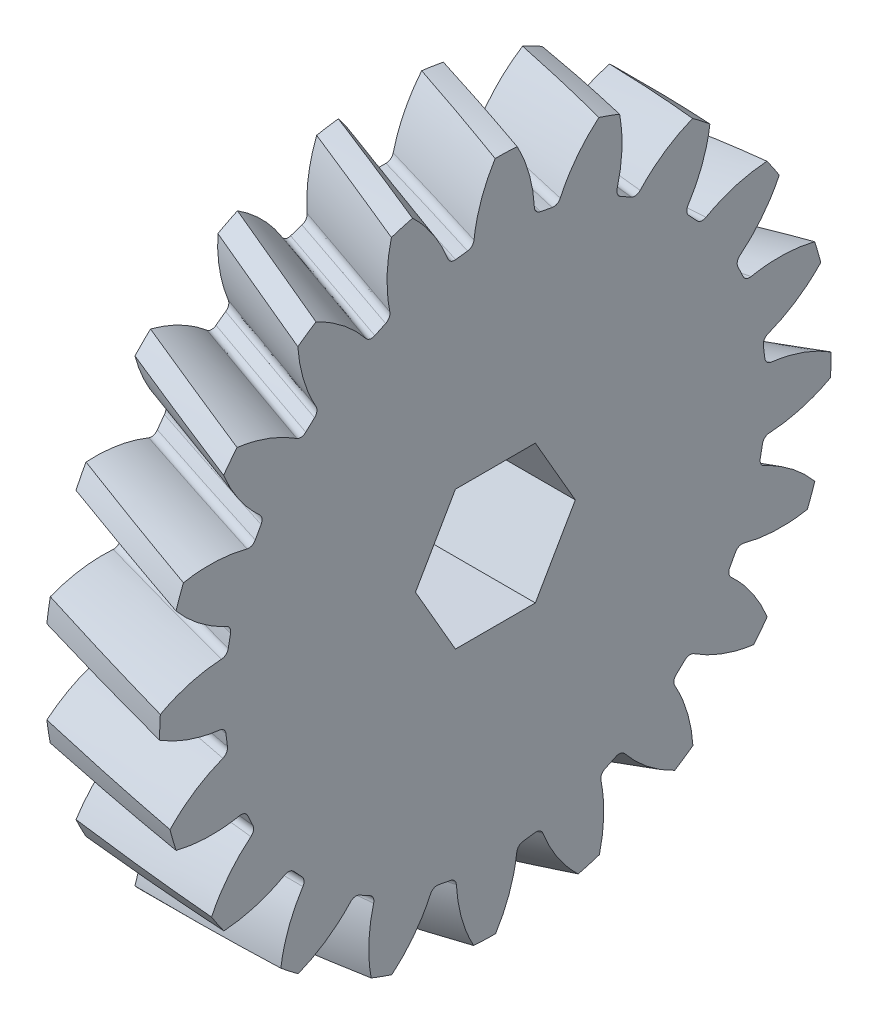
from build123d import *

# Parameters (mm, degrees)
BASPROSKE_W            = 5
BASPROSKE_H            = 14.552222156
TOOTHCUTRH_PITCH       = 251.213697794
TOOTHCUTRH_HEIGHT      = 5
TOOTHCUTRH_RADIUS      = 14.552222156
TOOTHCUTRH_START_ANGLE = -90
TEETHCUTSRH_COUNT      = 20
TEETHCUTSRH_ANGLE      = 342
BORSKE_R               = 0.4
BORE_DEPTH             = 62.5000025
CUT_EXTRUDE1_DEPTH     = 22.178629469


with BuildPart() as part:
    # BasProSke → Base-Revolve (revolve)
    with BuildSketch(Plane(origin=(0, 0, 0), x_dir=(1, 0, 0), z_dir=(0, 1, 0)), mode=Mode.PRIVATE) as base_revolve_sk:
        with Locations((2.5, 7.276111078)):
            Rectangle(BASPROSKE_W, BASPROSKE_H)
    revolve(base_revolve_sk.sketch.rotate(Axis((-10, 0, 0), (1, 0, 0)), 180), axis=Axis((-10, 0, 0), (1, 0, 0)))

    # ToothCutRH: sweep along a helix
    with BuildLine() as toothcutrh_path:
        add(Helix(TOOTHCUTRH_PITCH, TOOTHCUTRH_HEIGHT, TOOTHCUTRH_RADIUS, center=(0, 0, 0), direction=(1, 0, 0), mode=Mode.PRIVATE).rotate(Axis((0, 0, 0), (1, 0, 0)), TOOTHCUTRH_START_ANGLE))
    # TooCutSkeRH → ToothCutRH (sweep, cut)
    with BuildSketch(Plane(origin=(0, 0, 0), x_dir=(0, 0, -1), z_dir=(1, 0, 0))):
        with BuildLine():
            ThreePointArc((0.259377145, 11.73685647), (0, 11.739722156), (-0.259377145, 11.73685647))
            ThreePointArc((-0.259377145, 11.73685647), (-0.456880733, 11.801357046), (-0.57067814, 11.975190707))
            ThreePointArc((-0.57067814, 11.975190707), (-1.173068781, 13.509502704), (-2.155624332, 14.832972529))
            ThreePointArc((-2.155624332, 14.832972529), (0, 14.988788821), (2.155624332, 14.832972529))
            ThreePointArc((2.155624332, 14.832972529), (1.173068781, 13.509502704), (0.57067814, 11.975190707))
            ThreePointArc((0.57067814, 11.975190707), (0.456880733, 11.801357046), (0.259377145, 11.73685647))
        make_face()
    toothcutrh = sweep(path=toothcutrh_path.line, is_frenet=True, mode=Mode.SUBTRACT)

    # TeethCutsRH: ToothCutRH ×20 about axis
    teethcutsrh_axis = Axis((-10, 0, 0), (1, 0, 0))
    for i in range(1, TEETHCUTSRH_COUNT):
        add(toothcutrh.rotate(teethcutsrh_axis, i * TEETHCUTSRH_ANGLE / (TEETHCUTSRH_COUNT - 1)), mode=Mode.SUBTRACT)

    # BorSke → Bore (cut, symmetric)
    with BuildSketch(Plane(origin=(0, 0, 0), x_dir=(0, 0, -1), z_dir=(1, 0, 0))):
        with Locations(Location((0, 0, 0), (0, 0, 180))):
            Circle(BORSKE_R)
    extrude(amount=BORE_DEPTH, both=True, mode=Mode.SUBTRACT)

    # Sketch3 → Cut-Extrude1 (cut, through all)
    with BuildSketch(Plane(origin=(5, 0, 0), x_dir=(0, 0, -1), z_dir=(1, 0, 0))):
        Polygon((3.464101615, 0), (1.732050808, 3), (-1.732050808, 3), (-3.464101615, 0), (-1.732050808, -3), (1.732050808, -3), align=None)
    extrude(amount=-CUT_EXTRUDE1_DEPTH, mode=Mode.SUBTRACT)


solid = part.part
